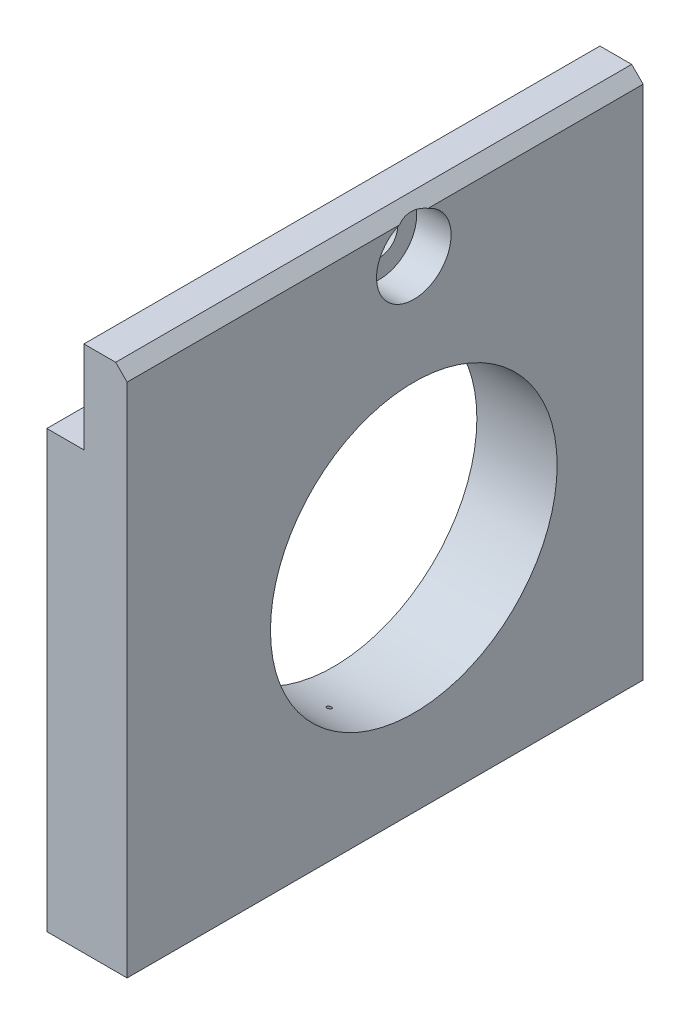
from build123d import *

# Parameters (mm, degrees)
BOSS_EXTRUDE1_DEPTH            = 45
CBORE_FOR_M3_SHCS1_D           = 3.2
CBORE_FOR_M3_SHCS1_CBORE_D     = 6.5
CBORE_FOR_M3_SHCS1_CBORE_DEPTH = 3
F_25_0_25_DIAMETER_HOLE1_D     = 25
CHAMFER1_SIZE                  = 1
M3X0_5_TAPPED_HOLE1_D          = 2.5
M3X0_5_TAPPED_HOLE1_DEPTH      = 7.5
M3X0_5_TAPPED_HOLE1_TIP        = 0.751075774
F_3_0MM_DOWEL_HOLE1_D          = 3
F_3_0MM_DOWEL_HOLE1_DEPTH      = 7.5
F_3_0MM_DOWEL_HOLE1_TIP        = 0.901290929


with BuildPart() as part:
    # Sketch1 → Boss-Extrude1 (new body)
    with BuildSketch(Plane.XY):
        Polygon((3.23, 30.362745098), (3.23, 22.362745098), (0, 22.362745098), (0, -15.637254902), (7, -15.637254902), (7, 30.362745098), align=None)
    extrude(amount=BOSS_EXTRUDE1_DEPTH)

    # CBORE for M3 SHCS1 (through all)
    with Locations(Plane(origin=(7, 0, 0), x_dir=(0, 0, -1), z_dir=(1, 0, 0))):
        with Locations((-20, 26.362745098)):
            CounterBoreHole(CBORE_FOR_M3_SHCS1_D / 2, CBORE_FOR_M3_SHCS1_CBORE_D / 2, CBORE_FOR_M3_SHCS1_CBORE_DEPTH)

    # Ø25.0 (25) Diameter Hole1 (through all)
    with Locations(Plane(origin=(7, 0, 0), x_dir=(0, 0, -1), z_dir=(1, 0, 0))):
        with Locations((-20, 4.362745098)):
            Hole(F_25_0_25_DIAMETER_HOLE1_D / 2)

    # Chamfer1
    # the kernel refuses this chamfer: 1 mm, written as the material it takes off along each edge
    with BuildSketch(Plane(origin=(7, 30.362745098, -2.571682988), x_dir=(-0.9996219169112968, 0.027495876610585623, 0), z_dir=(0, 0, 1))) as chamfer1_piece_1:
        Polygon((CHAMFER1_SIZE * 0.999621916911, CHAMFER1_SIZE * 0.0274958766106), (-CHAMFER1_SIZE * 0.0274958766106, CHAMFER1_SIZE * 0.999621916911), (0, 0), align=None)
    extrude(amount=50.143365976, mode=Mode.SUBTRACT)

    # M3x0.5 Tapped Hole1
    with Locations(Plane(origin=(0, -15.637254902, 0), x_dir=(-1, 0, 0), z_dir=(0, -1, 0))):
        with Locations((-3.5, -24)):
            Hole(M3X0_5_TAPPED_HOLE1_D / 2, depth=M3X0_5_TAPPED_HOLE1_DEPTH)
            with Locations((0, 0, -(M3X0_5_TAPPED_HOLE1_DEPTH + M3X0_5_TAPPED_HOLE1_TIP / 2))):  # 118° drill point
                Cone(0, M3X0_5_TAPPED_HOLE1_D / 2, M3X0_5_TAPPED_HOLE1_TIP, mode=Mode.SUBTRACT)

    # Ø3.0mm Dowel Hole1
    with Locations(Plane(origin=(0, -15.637254902, 0), x_dir=(-1, 0, 0), z_dir=(0, -1, 0))):
        with Locations((-3.5, -38), (-3.5, -7)):
            Hole(F_3_0MM_DOWEL_HOLE1_D / 2, depth=F_3_0MM_DOWEL_HOLE1_DEPTH)
            with Locations((0, 0, -(F_3_0MM_DOWEL_HOLE1_DEPTH + F_3_0MM_DOWEL_HOLE1_TIP / 2))):  # 118° drill point
                Cone(0, F_3_0MM_DOWEL_HOLE1_D / 2, F_3_0MM_DOWEL_HOLE1_TIP, mode=Mode.SUBTRACT)


solid = part.part
